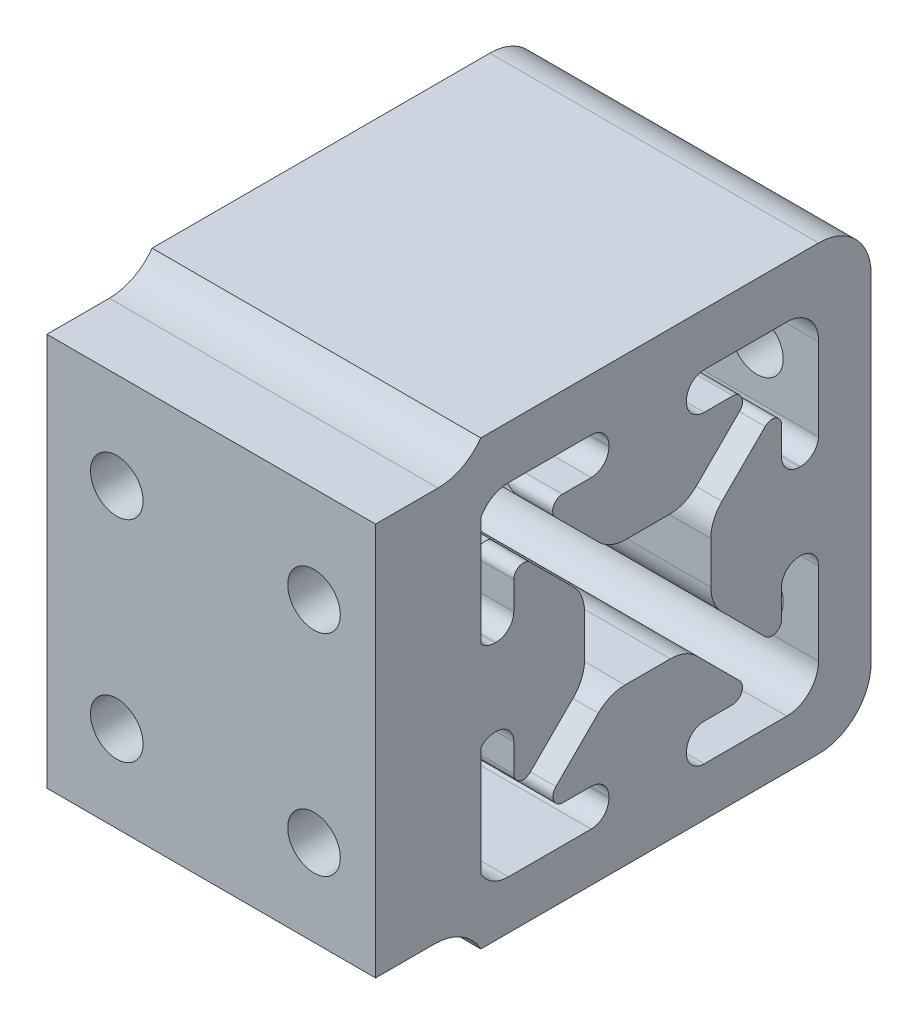
from build123d import *

# Parameters (mm, degrees)
SKETCH1_W                       = 25
SKETCH1_H                       = 29.9
SKETCH1_R                       = 2
BOSS_EXTRUDE1_DEPTH             = 5
BOSS_EXTRUDE2_REACH             = 22.595
BOSS_EXTRUDE2_DIRECTION_2_REACH = 22.595
FILLET1_R                       = 4
SKETCH5_R                       = 2
CUT_EXTRUDE1_DEPTH              = 41.699488517
BOSS_EXTRUDE3_START             = 3
SKETCH6_W                       = 25
SKETCH6_H                       = 29.9
SKETCH6_R                       = 2
BOSS_EXTRUDE3_DEPTH             = 3


with BuildPart() as part:
    # Sketch1 → Boss-Extrude1 (new body)
    with BuildSketch(Plane.XY):
        with Locations((-0.31541538, 0.377236794)):
            Rectangle(SKETCH1_W, SKETCH1_H)
        with Locations((-7.5, 8)):
            Circle(SKETCH1_R, mode=Mode.SUBTRACT)
        with Locations((7.5, 8)):
            Circle(SKETCH1_R, mode=Mode.SUBTRACT)
        with Locations((7.5, -8)):
            Circle(SKETCH1_R, mode=Mode.SUBTRACT)
        with Locations((-7.5, -8)):
            Circle(SKETCH1_R, mode=Mode.SUBTRACT)
    extrude(amount=BOSS_EXTRUDE1_DEPTH)

    # Boss-Extrude2: up to this face of the body (flat: up to its plane)
    boss_extrude2_end = Plane(part.part.faces().sort_by_distance((12.18458462, 0.377236794, 2.5))[0])
    # Sketch2 → Boss-Extrude2 (add, up to the picked face)
    with BuildSketch(Plane(origin=(0, 0, 0), x_dir=(0, 0, -1), z_dir=(1, 0, 0)), mode=Mode.PRIVATE) as boss_extrude2_sk1:
        with BuildLine():
            Line((0, -11.717138173), (0, -16.66232941))
            Line((0, -16.66232941), (29.68687664, -16.66232941))
            Line((29.68687664, -16.66232941), (29.68687664, 17.001002417))
            Line((29.68687664, 17.001002417), (0, 17.001002417))
            Line((0, 17.001002417), (0, 11.755811179))
            ThreePointArc((0, 11.755811179), (0.884733003, 12.666483957), (2.109549232, 13.001002417))
            Line((2.109549232, 13.001002417), (8.393265707, 13.001002417))
            ThreePointArc((8.393265707, 13.001002417), (9.346522311, 12.606150603), (9.741374125, 11.652893998))
            Line((9.741374125, 11.652893998), (9.741374125, 11.538108418))
            ThreePointArc((9.741374125, 11.538108418), (9.346522311, 10.584851814), (8.393265707, 10.19))
            Line((8.393265707, 10.19), (6.203989516, 10.19))
            ThreePointArc((6.203989516, 10.19), (5.524208418, 9.735578573), (5.684234421, 8.933710222))
            Line((5.684234421, 8.933710222), (8.989961975, 5.633523613))
            ThreePointArc((8.989961975, 5.633523613), (9.922082059, 5.011548715), (11.021176723, 4.793164779))
            Line((11.021176723, 4.793164779), (14.36569992, 4.793164779))
            ThreePointArc((14.36569992, 4.793164779), (15.464794584, 5.011548715), (16.396914668, 5.633523613))
            Line((16.396914668, 5.633523613), (19.702642222, 8.933710222))
            ThreePointArc((19.702642222, 8.933710222), (19.862668225, 9.735578573), (19.182887127, 10.19))
            Line((19.182887127, 10.19), (16.993610936, 10.19))
            ThreePointArc((16.993610936, 10.19), (16.040354332, 10.584851814), (15.645502518, 11.538108418))
            Line((15.645502518, 11.538108418), (15.645502518, 11.652893998))
            ThreePointArc((15.645502518, 11.652893998), (16.040354332, 12.606150603), (16.993610936, 13.001002417))
            Line((16.993610936, 13.001002417), (23.277327411, 13.001002417))
            ThreePointArc((23.277327411, 13.001002417), (25.012928132, 12.264523906), (25.686876643, 10.503699138))
            Line((25.686876643, 10.503699138), (25.686876643, 4.219982663))
            ThreePointArc((25.686876643, 4.219982663), (25.262293441, 3.322964681), (24.338768225, 2.959628292))
            Line((24.338768225, 2.959628292), (24.223982645, 2.959628292))
            ThreePointArc((24.223982645, 2.959628292), (23.27072604, 3.354480106), (22.875874226, 4.30773671))
            Line((22.875874226, 4.30773671), (22.875874226, 6.427534889))
            ThreePointArc((22.875874226, 6.427534889), (22.426283891, 7.100699915), (21.632243636, 6.943274709))
            Line((21.632243636, 6.943274709), (18.341273187, 3.65782047))
            ThreePointArc((18.341273187, 3.65782047), (17.71681076, 2.724517949), (17.497503985, 1.623195355))
            Line((17.497503985, 1.623195355), (17.497503985, -1.584522348))
            ThreePointArc((17.497503985, -1.584522348), (17.71681076, -2.685844942), (18.341273187, -3.619147463))
            Line((18.341273187, -3.619147463), (21.632243636, -6.904601703))
            ThreePointArc((21.632243636, -6.904601703), (22.426283891, -7.062026908), (22.875874226, -6.388861883))
            Line((22.875874226, -6.388861883), (22.875874226, -4.269063703))
            ThreePointArc((22.875874226, -4.269063703), (23.27072604, -3.315807099), (24.223982645, -2.920955285))
            Line((24.223982645, -2.920955285), (24.338768225, -2.920955285))
            ThreePointArc((24.338768225, -2.920955285), (25.292024829, -3.315807099), (25.686876643, -4.269063703))
            Line((25.686876643, -4.269063703), (25.686876643, -10.552780178))
            ThreePointArc((25.686876643, -10.552780178), (24.981136013, -12.25658878), (23.277327411, -12.96232941))
            Line((23.277327411, -12.96232941), (16.993610936, -12.96232941))
            ThreePointArc((16.993610936, -12.96232941), (16.040354332, -12.567477596), (15.645502518, -11.614220992))
            Line((15.645502518, -11.614220992), (15.645502518, -11.499435412))
            ThreePointArc((15.645502518, -11.499435412), (16.040354332, -10.546178807), (16.993610936, -10.151326993))
            Line((16.993610936, -10.151326993), (19.122506858, -10.151326993))
            ThreePointArc((19.122506858, -10.151326993), (19.843613638, -9.669260364), (19.673808836, -8.818643204))
            Line((19.673808836, -8.818643204), (16.446419226, -5.597150577))
            ThreePointArc((16.446419226, -5.597150577), (15.51435257, -4.975287739), (14.415358371, -4.756945365))
            Line((14.415358371, -4.756945365), (10.971518273, -4.756945365))
            ThreePointArc((10.971518273, -4.756945365), (9.872524073, -4.975287739), (8.940457417, -5.597150577))
            Line((8.940457417, -5.597150577), (5.713067808, -8.818643204))
            ThreePointArc((5.713067808, -8.818643204), (5.543263005, -9.669260364), (6.264369785, -10.151326993))
            Line((6.264369785, -10.151326993), (8.393265707, -10.151326993))
            ThreePointArc((8.393265707, -10.151326993), (9.346522311, -10.546178807), (9.741374125, -11.499435412))
            Line((9.741374125, -11.499435412), (9.741374125, -11.614220992))
            ThreePointArc((9.741374125, -11.614220992), (9.346522311, -12.567477596), (8.393265707, -12.96232941))
            Line((8.393265707, -12.96232941), (2.109549232, -12.96232941))
            ThreePointArc((2.109549232, -12.96232941), (0.884733003, -12.62781095), (0, -11.717138173))
        make_face()
    boss_extrude2_tool1 = split(extrude(boss_extrude2_sk1.sketch, amount=BOSS_EXTRUDE2_REACH, mode=Mode.PRIVATE), bisect_by=boss_extrude2_end, keep=Keep.BOTH, mode=Mode.PRIVATE)
    # Sketch2 → Boss-Extrude2 (add, up to the picked face)
    with BuildSketch(Plane(origin=(0, 0, 0), x_dir=(0, 0, -1), z_dir=(1, 0, 0)), mode=Mode.PRIVATE) as boss_extrude2_sk2:
        with BuildLine():
            Line((1.162893998, 2.959628292), (1.048108418, 2.959628292))
            ThreePointArc((1.048108418, 2.959628292), (0.467423341, 3.091101535), (0, 3.459877611))
            Line((0, 3.459877611), (0, -3.421204605))
            ThreePointArc((0, -3.421204605), (0.467423341, -3.052428529), (1.048108418, -2.920955285))
            Line((1.048108418, -2.920955285), (1.162893998, -2.920955285))
            ThreePointArc((1.162893998, -2.920955285), (2.116150603, -3.315807099), (2.511002417, -4.269063703))
            Line((2.511002417, -4.269063703), (2.511002417, -6.388861883))
            ThreePointArc((2.511002417, -6.388861883), (2.960592752, -7.062026908), (3.754633007, -6.904601703))
            Line((3.754633007, -6.904601703), (7.045603456, -3.619147463))
            ThreePointArc((7.045603456, -3.619147463), (7.670065883, -2.685844942), (7.889372658, -1.584522348))
            Line((7.889372658, -1.584522348), (7.889372658, 1.623195355))
            ThreePointArc((7.889372658, 1.623195355), (7.670065883, 2.724517949), (7.045603456, 3.65782047))
            Line((7.045603456, 3.65782047), (3.754633007, 6.943274709))
            ThreePointArc((3.754633007, 6.943274709), (2.960592752, 7.100699915), (2.511002417, 6.427534889))
            Line((2.511002417, 6.427534889), (2.511002417, 4.30773671))
            ThreePointArc((2.511002417, 4.30773671), (2.116150603, 3.354480106), (1.162893998, 2.959628292))
        make_face()
    boss_extrude2_tool2 = split(extrude(boss_extrude2_sk2.sketch, amount=BOSS_EXTRUDE2_REACH, mode=Mode.PRIVATE), bisect_by=boss_extrude2_end, keep=Keep.BOTH, mode=Mode.PRIVATE)
    add(boss_extrude2_tool1.solids().sort_by(Axis((0, 0.280667, -17.512243), (1, 0, 0)))[0])
    add(boss_extrude2_tool2.solids().sort_by(Axis((0, 0.019337, -4.026735), (1, 0, 0)))[0])

    # Boss-Extrude2 direction 2: up to this face of the body (flat: up to its plane)
    boss_extrude2_direction_2_end = Plane(part.part.faces().sort_by_distance((-12.81541538, 0.377236794, 2.5))[0])
    # Sketch2 → Boss-Extrude2 direction 2 (add, up to the picked face)
    with BuildSketch(Plane(origin=(0, 0, 0), x_dir=(0, 0, -1), z_dir=(1, 0, 0)), mode=Mode.PRIVATE) as boss_extrude2_direction_2_sk1:
        with BuildLine():
            Line((0, -11.717138173), (0, -16.66232941))
            Line((0, -16.66232941), (29.68687664, -16.66232941))
            Line((29.68687664, -16.66232941), (29.68687664, 17.001002417))
            Line((29.68687664, 17.001002417), (0, 17.001002417))
            Line((0, 17.001002417), (0, 11.755811179))
            ThreePointArc((0, 11.755811179), (0.884733003, 12.666483957), (2.109549232, 13.001002417))
            Line((2.109549232, 13.001002417), (8.393265707, 13.001002417))
            ThreePointArc((8.393265707, 13.001002417), (9.346522311, 12.606150603), (9.741374125, 11.652893998))
            Line((9.741374125, 11.652893998), (9.741374125, 11.538108418))
            ThreePointArc((9.741374125, 11.538108418), (9.346522311, 10.584851814), (8.393265707, 10.19))
            Line((8.393265707, 10.19), (6.203989516, 10.19))
            ThreePointArc((6.203989516, 10.19), (5.524208418, 9.735578573), (5.684234421, 8.933710222))
            Line((5.684234421, 8.933710222), (8.989961975, 5.633523613))
            ThreePointArc((8.989961975, 5.633523613), (9.922082059, 5.011548715), (11.021176723, 4.793164779))
            Line((11.021176723, 4.793164779), (14.36569992, 4.793164779))
            ThreePointArc((14.36569992, 4.793164779), (15.464794584, 5.011548715), (16.396914668, 5.633523613))
            Line((16.396914668, 5.633523613), (19.702642222, 8.933710222))
            ThreePointArc((19.702642222, 8.933710222), (19.862668225, 9.735578573), (19.182887127, 10.19))
            Line((19.182887127, 10.19), (16.993610936, 10.19))
            ThreePointArc((16.993610936, 10.19), (16.040354332, 10.584851814), (15.645502518, 11.538108418))
            Line((15.645502518, 11.538108418), (15.645502518, 11.652893998))
            ThreePointArc((15.645502518, 11.652893998), (16.040354332, 12.606150603), (16.993610936, 13.001002417))
            Line((16.993610936, 13.001002417), (23.277327411, 13.001002417))
            ThreePointArc((23.277327411, 13.001002417), (25.012928132, 12.264523906), (25.686876643, 10.503699138))
            Line((25.686876643, 10.503699138), (25.686876643, 4.219982663))
            ThreePointArc((25.686876643, 4.219982663), (25.262293441, 3.322964681), (24.338768225, 2.959628292))
            Line((24.338768225, 2.959628292), (24.223982645, 2.959628292))
            ThreePointArc((24.223982645, 2.959628292), (23.27072604, 3.354480106), (22.875874226, 4.30773671))
            Line((22.875874226, 4.30773671), (22.875874226, 6.427534889))
            ThreePointArc((22.875874226, 6.427534889), (22.426283891, 7.100699915), (21.632243636, 6.943274709))
            Line((21.632243636, 6.943274709), (18.341273187, 3.65782047))
            ThreePointArc((18.341273187, 3.65782047), (17.71681076, 2.724517949), (17.497503985, 1.623195355))
            Line((17.497503985, 1.623195355), (17.497503985, -1.584522348))
            ThreePointArc((17.497503985, -1.584522348), (17.71681076, -2.685844942), (18.341273187, -3.619147463))
            Line((18.341273187, -3.619147463), (21.632243636, -6.904601703))
            ThreePointArc((21.632243636, -6.904601703), (22.426283891, -7.062026908), (22.875874226, -6.388861883))
            Line((22.875874226, -6.388861883), (22.875874226, -4.269063703))
            ThreePointArc((22.875874226, -4.269063703), (23.27072604, -3.315807099), (24.223982645, -2.920955285))
            Line((24.223982645, -2.920955285), (24.338768225, -2.920955285))
            ThreePointArc((24.338768225, -2.920955285), (25.292024829, -3.315807099), (25.686876643, -4.269063703))
            Line((25.686876643, -4.269063703), (25.686876643, -10.552780178))
            ThreePointArc((25.686876643, -10.552780178), (24.981136013, -12.25658878), (23.277327411, -12.96232941))
            Line((23.277327411, -12.96232941), (16.993610936, -12.96232941))
            ThreePointArc((16.993610936, -12.96232941), (16.040354332, -12.567477596), (15.645502518, -11.614220992))
            Line((15.645502518, -11.614220992), (15.645502518, -11.499435412))
            ThreePointArc((15.645502518, -11.499435412), (16.040354332, -10.546178807), (16.993610936, -10.151326993))
            Line((16.993610936, -10.151326993), (19.122506858, -10.151326993))
            ThreePointArc((19.122506858, -10.151326993), (19.843613638, -9.669260364), (19.673808836, -8.818643204))
            Line((19.673808836, -8.818643204), (16.446419226, -5.597150577))
            ThreePointArc((16.446419226, -5.597150577), (15.51435257, -4.975287739), (14.415358371, -4.756945365))
            Line((14.415358371, -4.756945365), (10.971518273, -4.756945365))
            ThreePointArc((10.971518273, -4.756945365), (9.872524073, -4.975287739), (8.940457417, -5.597150577))
            Line((8.940457417, -5.597150577), (5.713067808, -8.818643204))
            ThreePointArc((5.713067808, -8.818643204), (5.543263005, -9.669260364), (6.264369785, -10.151326993))
            Line((6.264369785, -10.151326993), (8.393265707, -10.151326993))
            ThreePointArc((8.393265707, -10.151326993), (9.346522311, -10.546178807), (9.741374125, -11.499435412))
            Line((9.741374125, -11.499435412), (9.741374125, -11.614220992))
            ThreePointArc((9.741374125, -11.614220992), (9.346522311, -12.567477596), (8.393265707, -12.96232941))
            Line((8.393265707, -12.96232941), (2.109549232, -12.96232941))
            ThreePointArc((2.109549232, -12.96232941), (0.884733003, -12.62781095), (0, -11.717138173))
        make_face()
    boss_extrude2_direction_2_tool1 = split(extrude(boss_extrude2_direction_2_sk1.sketch, amount=-BOSS_EXTRUDE2_DIRECTION_2_REACH, mode=Mode.PRIVATE), bisect_by=boss_extrude2_direction_2_end, keep=Keep.BOTH, mode=Mode.PRIVATE)
    # Sketch2 → Boss-Extrude2 direction 2 (add, up to the picked face)
    with BuildSketch(Plane(origin=(0, 0, 0), x_dir=(0, 0, -1), z_dir=(1, 0, 0)), mode=Mode.PRIVATE) as boss_extrude2_direction_2_sk2:
        with BuildLine():
            Line((1.162893998, 2.959628292), (1.048108418, 2.959628292))
            ThreePointArc((1.048108418, 2.959628292), (0.467423341, 3.091101535), (0, 3.459877611))
            Line((0, 3.459877611), (0, -3.421204605))
            ThreePointArc((0, -3.421204605), (0.467423341, -3.052428529), (1.048108418, -2.920955285))
            Line((1.048108418, -2.920955285), (1.162893998, -2.920955285))
            ThreePointArc((1.162893998, -2.920955285), (2.116150603, -3.315807099), (2.511002417, -4.269063703))
            Line((2.511002417, -4.269063703), (2.511002417, -6.388861883))
            ThreePointArc((2.511002417, -6.388861883), (2.960592752, -7.062026908), (3.754633007, -6.904601703))
            Line((3.754633007, -6.904601703), (7.045603456, -3.619147463))
            ThreePointArc((7.045603456, -3.619147463), (7.670065883, -2.685844942), (7.889372658, -1.584522348))
            Line((7.889372658, -1.584522348), (7.889372658, 1.623195355))
            ThreePointArc((7.889372658, 1.623195355), (7.670065883, 2.724517949), (7.045603456, 3.65782047))
            Line((7.045603456, 3.65782047), (3.754633007, 6.943274709))
            ThreePointArc((3.754633007, 6.943274709), (2.960592752, 7.100699915), (2.511002417, 6.427534889))
            Line((2.511002417, 6.427534889), (2.511002417, 4.30773671))
            ThreePointArc((2.511002417, 4.30773671), (2.116150603, 3.354480106), (1.162893998, 2.959628292))
        make_face()
    boss_extrude2_direction_2_tool2 = split(extrude(boss_extrude2_direction_2_sk2.sketch, amount=-BOSS_EXTRUDE2_DIRECTION_2_REACH, mode=Mode.PRIVATE), bisect_by=boss_extrude2_direction_2_end, keep=Keep.BOTH, mode=Mode.PRIVATE)
    add(boss_extrude2_direction_2_tool1.solids().sort_by(Axis((0, 0.280667, -17.512243), (-1, 0, 0)))[0])
    add(boss_extrude2_direction_2_tool2.solids().sort_by(Axis((0, 0.019337, -4.026735), (-1, 0, 0)))[0])

    # Fillet1
    # the kernel refuses this fillet: 4 mm, written as the material it adds along each edge
    with BuildSketch(Plane(origin=(12.18458462, 15.327236794, 0), x_dir=(0, 1, 0), z_dir=(-1, 0, 0))) as fillet1_piece_1:
        with BuildLine():
            CenterArc((4, -3.254018073), FILLET1_R, 125.560240697, 54.439759303)
            Line((0, -3.254018073), (0, 0))
            Line((0, 0), (1.673765622, 0))
        make_face()
    extrude(amount=25)
    with BuildSketch(Plane(origin=(-12.81541538, -14.572763206, 0), x_dir=(0, 0, 1), z_dir=(1, 0, 0))) as fillet1_piece_2:
        with BuildLine():
            CenterArc((3.514291211, 4), FILLET1_R, 208.529322188, 61.470677812)
            Line((0, 2.089566205), (0, 0))
            Line((0, 0), (3.514291211, 0))
        make_face()
    extrude(amount=25)
    # the kernel refuses this fillet: 4 mm, written as the material it takes off along each edge
    with BuildSketch(Plane(origin=(22.18458462, 17.001002417, -29.68687664), x_dir=(0, 0, 1), z_dir=(-1, 0, 0))) as fillet1_2_piece_1:
        with BuildLine():
            CenterArc((FILLET1_R, -FILLET1_R), FILLET1_R, 90, 90)
            Line((0, -FILLET1_R), (0, 0))
            Line((0, 0), (FILLET1_R, 0))
        make_face()
    extrude(amount=45, mode=Mode.SUBTRACT)
    with BuildSketch(Plane(origin=(22.18458462, -16.66232941, -29.68687664), x_dir=(0, 0, 1), z_dir=(-1, 0, 0))) as fillet1_2_piece_2:
        with BuildLine():
            CenterArc((FILLET1_R, FILLET1_R), FILLET1_R, 180, 90)
            Line((0, FILLET1_R), (0, 0))
            Line((0, 0), (FILLET1_R, 0))
        make_face()
    extrude(amount=45, mode=Mode.SUBTRACT)

    # Sketch5 → Cut-Extrude1 (cut, through all)
    with BuildSketch(Plane.XY.offset(5)):
        with Locations((-7.5, -8)):
            Circle(SKETCH5_R)
        with Locations((7.5, -8)):
            Circle(SKETCH5_R)
        with Locations((7.5, 8)):
            Circle(SKETCH5_R)
        with Locations((-7.5, 8)):
            Circle(SKETCH5_R)
    extrude(amount=-CUT_EXTRUDE1_DEPTH, mode=Mode.SUBTRACT)

    # Sketch6 → Boss-Extrude3 (add)
    with BuildSketch(Plane.XY.offset(5).offset(BOSS_EXTRUDE3_START)):
        with Locations((-0.31541538, 0.377236794)):
            Rectangle(SKETCH6_W, SKETCH6_H)
        with Locations((-7.5, 8)):
            Circle(SKETCH6_R, mode=Mode.SUBTRACT)
        with Locations((7.5, 8)):
            Circle(SKETCH6_R, mode=Mode.SUBTRACT)
        with Locations((7.5, -8)):
            Circle(SKETCH6_R, mode=Mode.SUBTRACT)
        with Locations((-7.5, -8)):
            Circle(SKETCH6_R, mode=Mode.SUBTRACT)
    extrude(amount=-BOSS_EXTRUDE3_DEPTH)


solid = part.part
